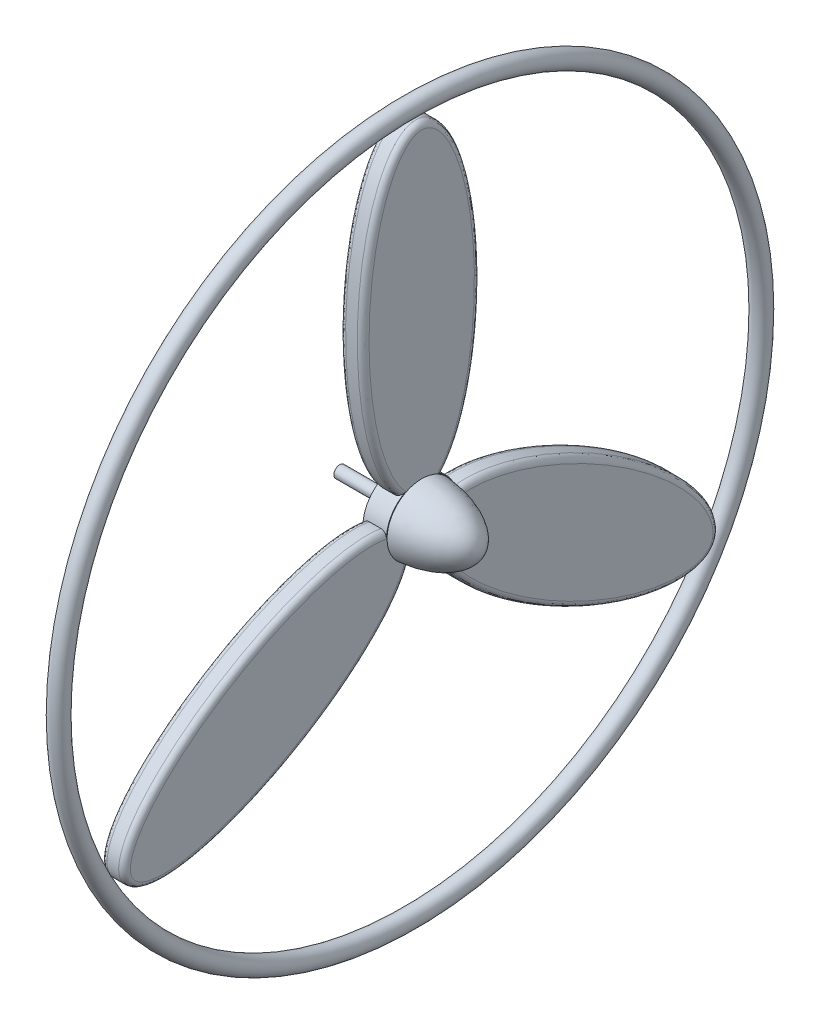
from build123d import *

# Parameters (mm, degrees)
SKETCH1_R                = 1.5
BOSS_EXTRUDE1_DEPTH      = 2
BOSS_EXTRUDE1_DEPTH_BACK = 2
FILLET3_R                = 1
SKETCH6_R                = 1
BOSS_EXTRUDE2_DEPTH      = 10


with BuildPart() as part:
    # Sketch1 → Revolve2 (revolve)
    with BuildSketch(Plane.XY):
        with Locations((0, 60)):
            Circle(SKETCH1_R)
    revolve(axis=Axis((-176.189858703, 0, 0), (1, 0, 0)))


with BuildPart() as body_2:
    # Sketch3 → Boss-Extrude1 (new, two sides: drawn at the far end of the back side and taken through both)
    with BuildSketch(Plane(origin=(0, 0, 0), x_dir=(0, 0, -1), z_dir=(1, 0, 0)).offset(-BOSS_EXTRUDE1_DEPTH_BACK)):
        with BuildLine():
            ThreePointArc((-3.592279303, 4.841764954), (-5.135590999, 3.157984096), (-5.941788308, 1.020935928))
            add(Edge.make_bspline(
                [(-5.941788308, 1.020935928), (-23.992269622, 4.451586438), (-44.80805169, -16.718175824), (-65.623833759, -37.887938086), (-36.882390814, -30.445823146), (-8.140947868, -23.003708206), (-2.086737704, -5.656207582)],
                knots=[3.53742716, 3.53742716, 3.53742716, 5.367932592, 5.367932592, 7.198438023, 7.198438023, 9.028943454, 9.028943454, 9.028943454], degree=2, weights=[1, 0.609590263, 1, 0.609590263, 1, 0.609590263, 1]))
            ThreePointArc((-2.086737704, -5.656207582), (0, -6.028860461), (2.086737704, -5.656207582))
            add(Edge.make_bspline(
                [(2.086737704, -5.656207582), (8.140947868, -23.003708206), (36.882390814, -30.445823146), (65.623833759, -37.887938086), (44.80805169, -16.718175824), (23.992269622, 4.451586438), (5.941788308, 1.020935928)],
                knots=[3.53742716, 3.53742716, 3.53742716, 5.367932592, 5.367932592, 7.198438023, 7.198438023, 9.028943454, 9.028943454, 9.028943454], degree=2, weights=[1, 0.609590263, 1, 0.609590263, 1, 0.609590263, 1]))
            ThreePointArc((5.941788308, 1.020935928), (5.135590999, 3.157984096), (3.592279303, 4.841764954))
            add(Edge.make_bspline(
                [(3.592279303, 4.841764954), (15.969012991, 18.064661731), (7.984506496, 47.455000371), (0, 76.845339011), (-7.984506496, 47.455000371), (-15.969012991, 18.064661731), (-3.592279303, 4.841764954)],
                knots=[0.36744047, 0.36744047, 0.36744047, 2.216875259, 2.216875259, 4.066310048, 4.066310048, 5.915744837, 5.915744837, 5.915744837], degree=2, weights=[1, 0.602060263, 1, 0.602060263, 1, 0.602060263, 1]))
        make_face()
    extrude(amount=BOSS_EXTRUDE1_DEPTH + BOSS_EXTRUDE1_DEPTH_BACK)

    # Sketch5 → Revolve4 (revolve)
    with BuildSketch(Plane.XY):
        with BuildLine():
            Line((0, 6), (0, 0))
            Line((0, 0), (12, 0))
            add(Edge.make_bspline(
                [(12, 0), (12, 6), (0, 6)],
                knots=[3.141592654, 3.141592654, 3.141592654, 4.71238898, 4.71238898, 4.71238898], degree=2, weights=[1, 0.707106781, 1]))
        make_face()
    revolve(axis=Axis((-19.833451803, 0, 0), (1, 0, 0)))

    # Fillet3
    fillet3_edges = [body_2.edges().sort_by_distance(p)[0] for p in [
        (-2, 58.5, -1.9313e-05),
        (2, 58.5, -1.9313e-05),
        (-2, -28.999985276, 50.22948192),
        (2, -28.999985276, 50.22948192),
        (-2, -29.000014724, -50.229464919),
        (2, -29.000014724, -50.229464919),
    ]]
    fillet(fillet3_edges, radius=FILLET3_R)

    # Sketch6 → Boss-Extrude2 (add)
    with BuildSketch(Plane.ZY.offset(2)):
        Circle(SKETCH6_R)
    extrude(amount=BOSS_EXTRUDE2_DEPTH)


solid = Compound([part.part, body_2.part])
